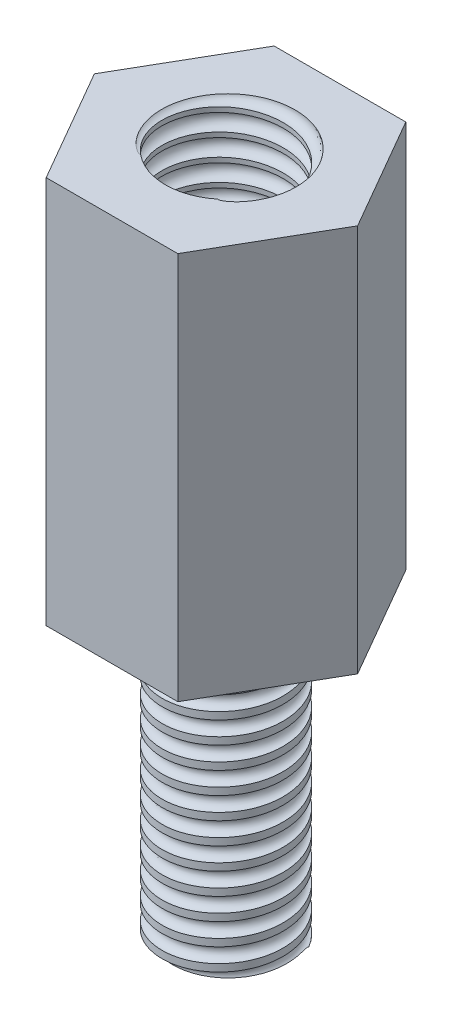
from build123d import *

# Parameters (mm, degrees)
BOSS_EXTRUDE1_DEPTH = 8
SKETCH2_R           = 1.25
BOSS_EXTRUDE2_DEPTH = 6
CUT_SWEEP3_PITCH    = 0.45
SKETCH9_R           = 1.25
CUT_EXTRUDE1_DEPTH  = 6
CUT_SWEEP4_PITCH    = 0.45


with BuildPart() as part:
    # Sketch1 → Boss-Extrude1 (new body)
    with BuildSketch(Plane(origin=(0, 0, 0), x_dir=(1, 0, 0), z_dir=(0, 1, 0))):
        Polygon((1.356773133, -2.35), (2.713546265, 0), (1.356773133, 2.35), (-1.356773133, 2.35), (-2.713546265, 0), (-1.356773133, -2.35), align=None)
    extrude(amount=BOSS_EXTRUDE1_DEPTH)

    # Sketch2 → Boss-Extrude2 (add)
    with BuildSketch(Plane.XZ):
        with Locations(Location((0, 0, 0), (0, 0, 270))):
            Circle(SKETCH2_R)
    extrude(amount=BOSS_EXTRUDE2_DEPTH)

    # Cut-Sweep3: arcs per turn and ends read off the stored shape
    # Cut-Sweep3: the profile of Sketch5 screwed along a right-hand helix through 14.25 turns, 6 arcs to a turn; built about Z, then put on its axis
    cut_sweep3_z = Axis((0, 0, 0), (0, 0, 1))
    cut_sweep3_corners = [(1.1, 0, -0.45), (1.25, 0, -0.3), (1.4, 0, -0.45), (1.25, 0, -0.6)]
    with BuildLine(mode=Mode.PRIVATE) as cut_sweep3_profile:
        ThreePointArc((1.1, 0, -0.45), (1.143933983, 0, -0.343933983), (1.25, 0, -0.3))
        ThreePointArc((1.25, 0, -0.3), (1.356066017, 0, -0.343933983), (1.4, 0, -0.45))
        ThreePointArc((1.4, 0, -0.45), (1.356066017, 0, -0.556066017), (1.25, 0, -0.6))
        ThreePointArc((1.25, 0, -0.6), (1.143933983, 0, -0.556066017), (1.1, 0, -0.45))
    cut_sweep3_cap = Face(cut_sweep3_profile.wire())
    cut_sweep3_arcs = [((1.1, 0, -0.45), (1.1, 0, -0.3), (1.25, 0, -0.3), (1, 0.7071067811865476, 1)), ((1.25, 0, -0.3), (1.4, 0, -0.3), (1.4, 0, -0.45), (1, 0.7071067811865476, 1)), ((1.4, 0, -0.45), (1.4, 0, -0.6), (1.25, 0, -0.6), (1, 0.7071067811865476, 1)), ((1.25, 0, -0.6), (1.1, 0, -0.6), (1.1, 0, -0.45), (1, 0.7071067811865476, 1))]  # start, shoulder, end, weights
    cut_sweep3_turn_angles = [0, 30, 60, 90, 120, 150, 180, 210, 240, 270, 300, 330, 360]
    cut_sweep3_turn_weights = [1, 0.8660254037844387, 1, 0.8660254037844387, 1, 0.8660254037844387, 1, 0.8660254037844387, 1, 0.8660254037844387, 1, 0.8660254037844387, 1]
    cut_sweep3_turn_sides = [Face.make_bezier_surface([[Vector(p[j][0], p[j][1], 0).rotate(cut_sweep3_z, cut_sweep3_turn_angles[2 * i + k]) / cut_sweep3_turn_weights[2 * i + k] + Vector(0, 0, p[j][2] + CUT_SWEEP3_PITCH * cut_sweep3_turn_angles[2 * i + k] / 360) for k in range(3)] for j in range(3)], [[p[3][j] * cut_sweep3_turn_weights[2 * i + k] for k in range(3)] for j in range(3)]) for p in cut_sweep3_arcs for i in range(6)]
    cut_sweep3_last_angles = [5040, 5070, 5100, 5115, 5130]
    cut_sweep3_last_weights = [1, 0.8660254037844387, 1, 0.9659258262890683, 1]
    cut_sweep3_last_sides = [Face.make_bezier_surface([[Vector(p[j][0], p[j][1], 0).rotate(cut_sweep3_z, cut_sweep3_last_angles[2 * i + k]) / cut_sweep3_last_weights[2 * i + k] + Vector(0, 0, p[j][2] + CUT_SWEEP3_PITCH * cut_sweep3_last_angles[2 * i + k] / 360) for k in range(3)] for j in range(3)], [[p[3][j] * cut_sweep3_last_weights[2 * i + k] for k in range(3)] for j in range(3)]) for p in cut_sweep3_arcs for i in range(2)]
    cut_sweep3 = Plane(origin=(0, -6, 0), x_dir=(0, 0, 1), z_dir=(0, 1, 0)) * Solid(Shell([*[p.moved(Location((0, 0, CUT_SWEEP3_PITCH * i))) for i in range(14) for p in cut_sweep3_turn_sides], *cut_sweep3_last_sides, cut_sweep3_cap, cut_sweep3_cap.rotate(cut_sweep3_z, 5130).moved(Location((0, 0, CUT_SWEEP3_PITCH * 5130 / 360)))]))
    add(cut_sweep3, mode=Mode.SUBTRACT)

    # Sketch9 → Cut-Extrude1 (cut)
    with BuildSketch(Plane(origin=(0, 8, 0), x_dir=(1, 0, 0), z_dir=(0, 1, 0))):
        with Locations(Location((0, 0, 0), (0, 0, 270))):
            Circle(SKETCH9_R)
    extrude(amount=-CUT_EXTRUDE1_DEPTH, mode=Mode.SUBTRACT)

    # Cut-Sweep4: arcs per turn and ends read off the stored shape
    # Cut-Sweep4: the profile of Sketch11 screwed along a right-hand helix through 14.25 turns, 6 arcs to a turn; built about Z, then put on its axis
    cut_sweep4_z = Axis((0, 0, 0), (0, 0, 1))
    cut_sweep4_corners = [(1.425, 0, -0.45), (1.25, 0, -0.625), (1.075, 0, -0.45), (1.25, 0, -0.275)]
    with BuildLine(mode=Mode.PRIVATE) as cut_sweep4_profile:
        ThreePointArc((1.425, 0, -0.45), (1.373743687, 0, -0.573743687), (1.25, 0, -0.625))
        ThreePointArc((1.25, 0, -0.625), (1.126256313, 0, -0.573743687), (1.075, 0, -0.45))
        ThreePointArc((1.075, 0, -0.45), (1.126256313, 0, -0.326256313), (1.25, 0, -0.275))
        ThreePointArc((1.25, 0, -0.275), (1.373743687, 0, -0.326256313), (1.425, 0, -0.45))
    cut_sweep4_cap = Face(cut_sweep4_profile.wire())
    cut_sweep4_arcs = [((1.425, 0, -0.45), (1.425, 0, -0.625), (1.25, 0, -0.625), (1, 0.7071067811865476, 1)), ((1.25, 0, -0.625), (1.075, 0, -0.625), (1.075, 0, -0.45), (1, 0.7071067811865476, 1)), ((1.075, 0, -0.45), (1.075, 0, -0.275), (1.25, 0, -0.275), (1, 0.7071067811865476, 1)), ((1.25, 0, -0.275), (1.425, 0, -0.275), (1.425, 0, -0.45), (1, 0.7071067811865476, 1))]  # start, shoulder, end, weights
    cut_sweep4_turn_angles = [0, 30, 60, 90, 120, 150, 180, 210, 240, 270, 300, 330, 360]
    cut_sweep4_turn_weights = [1, 0.8660254037844387, 1, 0.8660254037844387, 1, 0.8660254037844387, 1, 0.8660254037844387, 1, 0.8660254037844387, 1, 0.8660254037844387, 1]
    cut_sweep4_turn_sides = [Face.make_bezier_surface([[Vector(p[j][0], p[j][1], 0).rotate(cut_sweep4_z, cut_sweep4_turn_angles[2 * i + k]) / cut_sweep4_turn_weights[2 * i + k] + Vector(0, 0, p[j][2] + CUT_SWEEP4_PITCH * cut_sweep4_turn_angles[2 * i + k] / 360) for k in range(3)] for j in range(3)], [[p[3][j] * cut_sweep4_turn_weights[2 * i + k] for k in range(3)] for j in range(3)]) for p in cut_sweep4_arcs for i in range(6)]
    cut_sweep4_last_angles = [5040, 5070, 5100, 5115, 5130]
    cut_sweep4_last_weights = [1, 0.8660254037844387, 1, 0.9659258262890683, 1]
    cut_sweep4_last_sides = [Face.make_bezier_surface([[Vector(p[j][0], p[j][1], 0).rotate(cut_sweep4_z, cut_sweep4_last_angles[2 * i + k]) / cut_sweep4_last_weights[2 * i + k] + Vector(0, 0, p[j][2] + CUT_SWEEP4_PITCH * cut_sweep4_last_angles[2 * i + k] / 360) for k in range(3)] for j in range(3)], [[p[3][j] * cut_sweep4_last_weights[2 * i + k] for k in range(3)] for j in range(3)]) for p in cut_sweep4_arcs for i in range(2)]
    cut_sweep4 = Plane(origin=(0, 8, 0), x_dir=(0, 0, -1), z_dir=(0, -1, 0)) * Solid(Shell([*[p.moved(Location((0, 0, CUT_SWEEP4_PITCH * i))) for i in range(14) for p in cut_sweep4_turn_sides], *cut_sweep4_last_sides, cut_sweep4_cap, cut_sweep4_cap.rotate(cut_sweep4_z, 5130).moved(Location((0, 0, CUT_SWEEP4_PITCH * 5130 / 360)))]))
    add(cut_sweep4, mode=Mode.SUBTRACT)


solid = part.part
